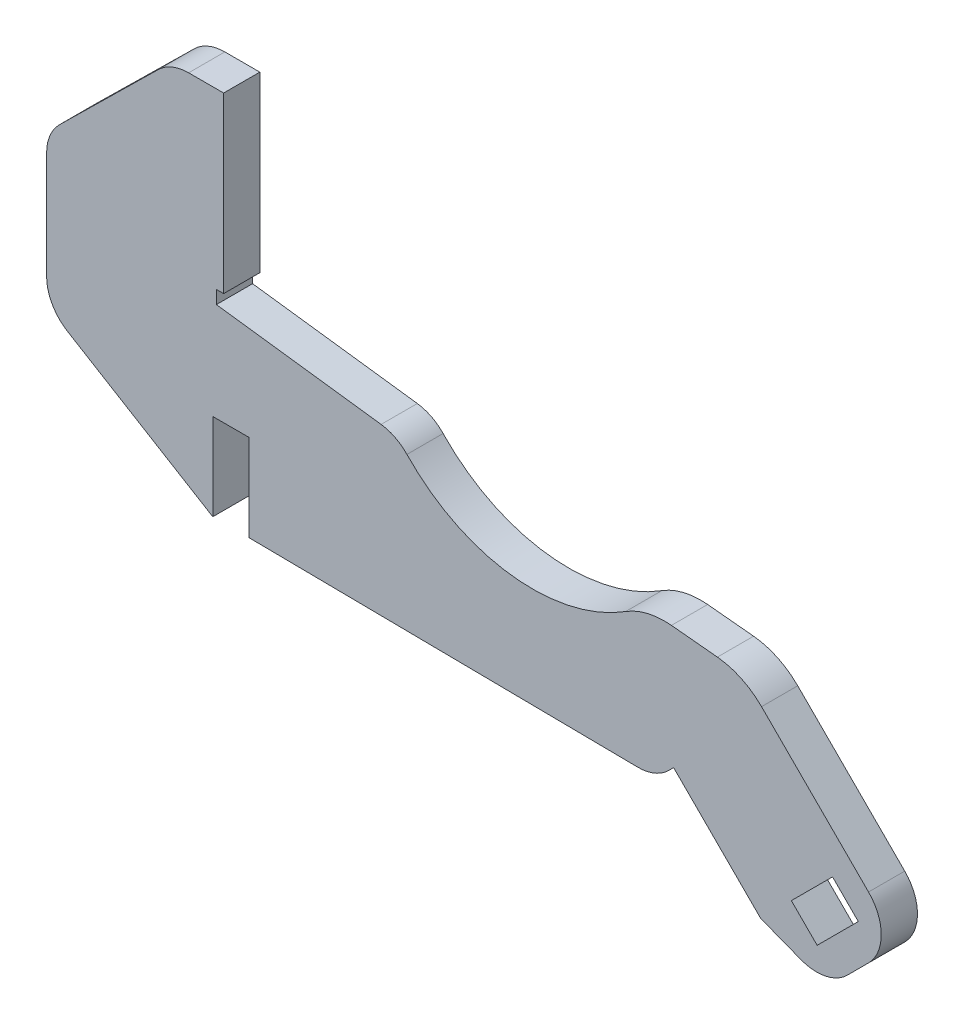
from build123d import *

# Parameters (mm, degrees)
BOSS_EXTRUDE1_DEPTH = 0.125
FILLET1_R           = 0.3
FILLET2_R           = 0.5


with BuildPart() as part:
    # frame_outline → Boss-Extrude1 (new, symmetric)
    with BuildSketch(Plane.XY):
        with BuildLine():
            Line((-0.05, -0.4), (-0.05, -1.6))
            Line((-0.05, -1.6), (-0.1, -1.6))
            Line((-0.1, -1.6), (-0.1, -1.690631342))
            Line((-0.1, -1.690631342), (1.149530794, -1.853054692))
            ThreePointArc((1.149530794, -1.853054692), (1.967232196, -2.294374324), (2.854868829, -2.019602037))
            Line((2.854868829, -2.019602037), (3.538793019, -2.08639569))
            Line((3.538793019, -2.08639569), (4.616700174, -3.164302846))
            Line((4.616700174, -3.164302846), (4.120311214, -3.660691806))
            Line((4.120311214, -3.660691806), (3.659277593, -3.482500897))
            Line((3.659277593, -3.482500897), (3.058236829, -2.881460133))
            Line((3.058236829, -2.881460133), (2.935621241, -3.004075721))
            Line((2.935621241, -3.004075721), (0.125, -2.972356033))
            Line((0.125, -2.972356033), (0.125, -2.372356033))
            Line((0.125, -2.372356033), (-0.125, -2.372356033))
            Line((-0.125, -2.372356033), (-0.125, -2.972356033))
            Line((-0.125, -2.972356033), (-1.272695348, -2.277821671))
            Line((-1.272695348, -2.277821671), (-1.272695348, -1.243831616))
            Line((-1.272695348, -1.243831616), (-0.414440871, -0.4))
            Line((-0.414440871, -0.4), (-0.05, -0.4))
        make_face()
        Polygon((3.871409627, -3.270368863), (4.049600536, -3.448559772), (4.333857462, -3.164302846), (4.155666553, -2.986111937), align=None, mode=Mode.SUBTRACT)
    extrude(amount=BOSS_EXTRUDE1_DEPTH, both=True)

    # Fillet1
    fillet1_edges = [part.edges().sort_by_distance(p)[0] for p in [
        (4.616700174, -3.164302846, 0),
        (4.120311214, -3.660691806, 0),
        (1.149530794, -1.853054692, 0),
        (-0.414440871, -0.4, 0),
        (-1.272695348, -1.243831616, 0),
        (-1.272695348, -2.277821671, 0),
        (2.935621241, -3.004075721, 0),
    ]]
    fillet(fillet1_edges, radius=FILLET1_R)

    # Fillet2
    fillet2_edges = [part.edges().sort_by_distance(p)[0] for p in [
        (3.538793019, -2.08639569, 0),
        (2.854868829, -2.019602037, 0),
    ]]
    fillet(fillet2_edges, radius=FILLET2_R)


solid = part.part
